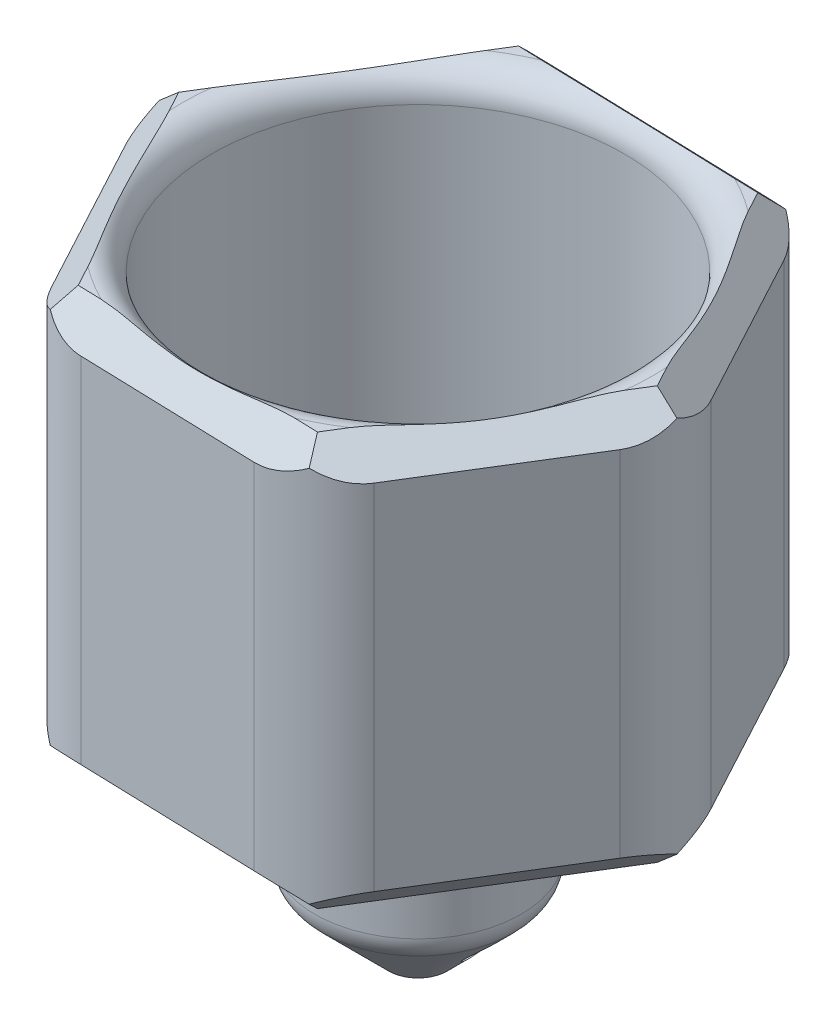
from build123d import *

# Parameters (mm, degrees)
ESQUISSE1_R                  = 0.7
BOSS_EXTRU_1_DEPTH           = 1.3
BOSS_EXTRU_2_DEPTH           = 0.1
CHANFREIN1_SIZE              = 0.1
CONG_1_R                     = 0.3
ESQUISSE3_R                  = 0.35
BOSS_EXTRU_3_DEPTH           = 0.7
CHANFREIN2_SIZE              = 0.25
CONG_2_R                     = 0.1
CONG_3_R                     = 0.1
ENL_V_MAT_EXTRU_1_DEPTH      = 0.7
ENL_V_MAT_EXTRU_1_DEPTH_BACK = 0.7
ESQUISSE4_R                  = 0.05
CONG_4_R                     = 0.1
ESQUISSE5_R                  = 0.225
ENL_V_MAT_EXTRU_2_DEPTH      = 0.5
CONG_5_R                     = 0.2
ECHELLE1_SCALE               = 10


with BuildPart() as part:
    # Esquisse1 → Boss.-Extru.1 (new body)
    with BuildSketch(Plane(origin=(0, 0, 0), x_dir=(1, 0, 0), z_dir=(0, 1, 0))):
        Polygon((0.501147742, 0.810154887), (-0.451040842, 0.839084119), (-0.952188584, 0.028929232), (-0.501147742, -0.810154887), (0.451040842, -0.839084119), (0.952188584, -0.028929232), align=None)
        with Locations(Location((0, 0, 0), (0, 0, 270))):
            Circle(ESQUISSE1_R, mode=Mode.SUBTRACT)
    extrude(amount=BOSS_EXTRU_1_DEPTH)

    # Esquisse2 → Boss.-Extru.2 (add)
    with BuildSketch(Plane.XZ):
        Polygon((0.501147742, -0.810154887), (0.952188584, 0.028929232), (0.451040842, 0.839084119), (-0.501147742, 0.810154887), (-0.952188584, -0.028929232), (-0.451040842, -0.839084119), align=None)
    extrude(amount=BOSS_EXTRU_2_DEPTH)

    # Chanfrein1
    chanfrein1_edges = [part.edges().sort_by_distance(p)[0] for p in [
        (-0.701614713, 1.3, -0.434006676),
        (-0.726668163, 1.3, 0.390612827),
        (-0.02505345, 1.3, 0.824619503),
        (0.701614713, 1.3, 0.434006676),
        (0.02505345, -0.1, -0.824619503),
        (0.726668163, -0.1, -0.390612827),
        (0.701614713, -0.1, 0.434006676),
        (-0.02505345, -0.1, 0.824619503),
        (-0.726668163, -0.1, 0.390612827),
        (-0.701614713, -0.1, -0.434006676),
        (0.726668163, 1.3, -0.390612827),
        (0.02505345, 1.3, -0.824619503),
    ]]
    chamfer(chanfrein1_edges, length=CHANFREIN1_SIZE)

    # Congé1
    cong_1_edges = [part.edges().sort_by_distance(p)[0] for p in [
        (0.501147742, 0.6, -0.810154887),
        (-0.451040842, 0.6, -0.839084119),
        (0.952188584, 0.6, 0.028929232),
        (0.451040842, 0.6, 0.839084119),
        (-0.501147742, 0.6, 0.810154887),
        (-0.952188584, 0.6, -0.028929232),
    ]]
    fillet(cong_1_edges, radius=CONG_1_R)

    # Esquisse3 → Boss.-Extru.3 (add)
    with BuildSketch(Plane(origin=(0, -0.1, 0), x_dir=(-1, 0, 0), z_dir=(0, -1, 0))):
        with Locations(Location((0, 0, 0), (0, 0, 90))):
            Circle(ESQUISSE3_R)
    extrude(amount=BOSS_EXTRU_3_DEPTH)

    # Chanfrein2
    chanfrein2_edges = [part.edges().sort_by_distance(p)[0] for p in [
        (0, -0.8, 0.35),
    ]]
    chamfer(chanfrein2_edges, length=CHANFREIN2_SIZE)

    # Congé2
    # the kernel refuses this fillet: 0.1 mm, written as the material it takes off along each edge
    with BuildSketch(Plane(origin=(0, 1.3, 0), x_dir=(0, 0, 1), z_dir=(-1, 0, 0))) as cong_2_piece_1:
        with BuildLine():
            CenterArc((0.7 + CONG_2_R, -CONG_2_R), CONG_2_R, 90, 90)
            Line((0.7, -CONG_2_R), (0.7, 0))
            Line((0.7, 0), (0.7 + CONG_2_R, 0))
        make_face()
    revolve(axis=Axis((0, 1.3, 0), (0, 1, 0)), mode=Mode.SUBTRACT)

    # Congé3
    cong_3_edges = [part.edges().sort_by_distance(p)[0] for p in [
        (0, -0.1, 0.35),
    ]]
    fillet(cong_3_edges, radius=CONG_3_R)

    # Esquisse4 → Enlèv. mat.-Extru.1 (cut, two sides: drawn at the far end of the back side and taken through both)
    with BuildSketch(Plane(origin=(0, 0, 0), x_dir=(0, 0, -1), z_dir=(1, 0, 0)).offset(-ENL_V_MAT_EXTRU_1_DEPTH_BACK)):
        with Locations(Location((0, -0.68, 0), (0, 0, 297.173904779))):
            Circle(ESQUISSE4_R)
    extrude(amount=ENL_V_MAT_EXTRU_1_DEPTH + ENL_V_MAT_EXTRU_1_DEPTH_BACK, mode=Mode.SUBTRACT)

    # Congé4
    cong_4_edges = [part.edges().sort_by_distance(p)[0] for p in [
        (0, -0.55, 0.35),
    ]]
    fillet(cong_4_edges, radius=CONG_4_R)

    # Esquisse5 → Enlèv. mat.-Extru.2 (cut)
    with BuildSketch(Plane(origin=(0, 0, 0), x_dir=(1, 0, 0), z_dir=(0, 1, 0))):
        with Locations(Location((0, 0, 0), (0, 0, 270))):
            Circle(ESQUISSE5_R)
    extrude(amount=-ENL_V_MAT_EXTRU_2_DEPTH, mode=Mode.SUBTRACT)

    # Congé5
    cong_5_edges = [part.edges().sort_by_distance(p)[0] for p in [
        (0, 0, -0.225),
    ]]
    fillet(cong_5_edges, radius=CONG_5_R)


with BuildPart() as part_1:
    # Echelle1: scaled about (0, 0, 0)
    add(part.part.scale(ECHELLE1_SCALE))


solid = part_1.part
